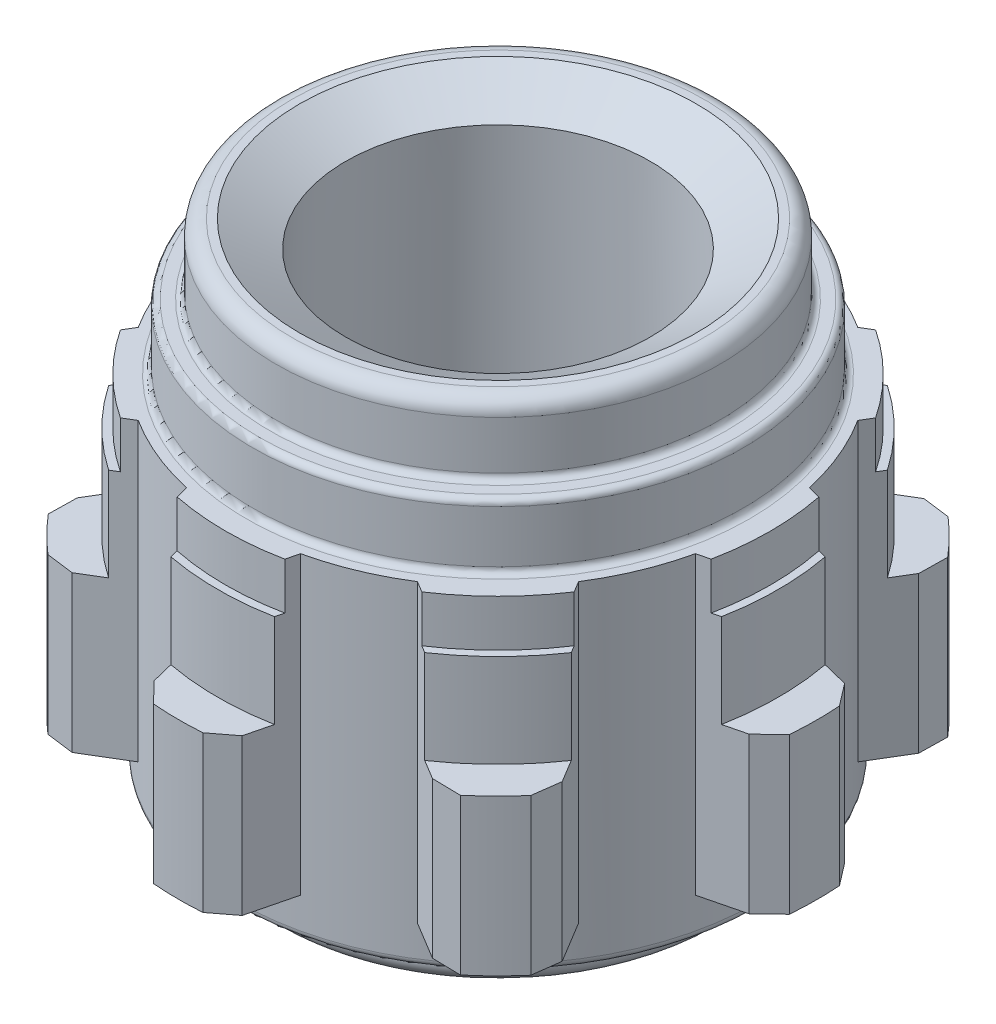
from build123d import *

# Parameters (mm, degrees)
CORTE_EXTRUS_O3_DEPTH = 93.584579839
CHANFRO1_SIZE         = 2.5
CHANFRO1_SIZE_2       = 1.443375673
CHANFRO1_SIZE_3       = 2.004509131
CHANFRO2_SIZE         = 6
CHANFRO2_SIZE2        = 3.422823391
CHANFRO3_SIZE         = 6
CHANFRO3_SIZE2        = 3.507995763
FILETE2_R             = 2
FILETE3_R             = 2
FILETE4_R             = 1
FILETE5_R             = 0.8
FILETE6_R             = 0.8


with BuildPart() as part:
    # Esboço1 → Revolução1 (revolve)
    with BuildSketch(Plane.XY):
        Polygon((40.409728023, 23.3), (49.409728023, 23.3), (49.409728023, 14.3), (52.409728023, 14.3), (52.409728023, 6), (55.909728023, 6), (55.909728023, 0), (56.909728023, 0), (56.909728023, -12), (61.909728023, -12), (61.909728023, -32), (54.409728023, -32), (54.409728023, -37), (49.409728023, -37), (49.409728023, -42), (41.799642187, -42), align=None)
    revolve(axis=Axis((20.909728023, -57.083369099, 0), (0, 1, 0)))

    # Esboço2 → Corte-extrusão3 (cut, through all)
    with BuildSketch(Plane.XZ.offset(32)):
        with BuildLine():
            ThreePointArc((-11.616680712, 24.960623686), (-16.96933281, 15.690020727), (-19.739742432, 5.349817913))
            Line((-19.739742432, 5.349817913), (-11.780061536, 7.323090779))
            ThreePointArc((-11.780061536, 7.323090779), (-10.040236316, 12.819894984), (-7.383650999, 17.936964724))
            Line((-7.383650999, 17.936964724), (-11.616680712, 24.960623686))
        make_face()
        with BuildLine():
            ThreePointArc((15.55991011, 40.649470455), (5.219707296, 37.879060833), (-4.050895663, 32.526408735))
            Line((-4.050895663, 32.526408735), (2.972763299, 28.293379022))
            ThreePointArc((2.972763299, 28.293379022), (8.089833039, 30.949964339), (13.586637245, 32.68978956))
            Line((13.586637245, 32.68978956), (15.55991011, 40.649470455))
        make_face()
        with BuildLine():
            ThreePointArc((45.870351709, 32.526408735), (36.59974875, 37.879060833), (26.259545937, 40.649470455))
            Line((26.259545937, 40.649470455), (28.232818802, 32.68978956))
            ThreePointArc((28.232818802, 32.68978956), (33.729623008, 30.949964339), (38.846692748, 28.293379022))
            Line((38.846692748, 28.293379022), (45.870351709, 32.526408735))
        make_face()
        with BuildLine():
            ThreePointArc((61.559198479, 5.349817913), (58.788788856, 15.690020727), (53.436136759, 24.960623686))
            Line((53.436136759, 24.960623686), (49.203107045, 17.936964724))
            ThreePointArc((49.203107045, 17.936964724), (51.859692363, 12.819894984), (53.599517583, 7.323090779))
            Line((53.599517583, 7.323090779), (61.559198479, 5.349817913))
        make_face()
        with BuildLine():
            Line((49.203107045, -17.936964724), (53.436136759, -24.960623686))
            ThreePointArc((53.436136759, -24.960623686), (58.788788856, -15.690020727), (61.559198479, -5.349817913))
            Line((61.559198479, -5.349817913), (53.599517583, -7.323090779))
            ThreePointArc((53.599517583, -7.323090779), (51.859692363, -12.819894984), (49.203107045, -17.936964724))
        make_face()
        with BuildLine():
            Line((28.232818802, -32.68978956), (26.259545937, -40.649470455))
            ThreePointArc((26.259545937, -40.649470455), (36.59974875, -37.879060833), (45.870351709, -32.526408735))
            Line((45.870351709, -32.526408735), (38.846692748, -28.293379022))
            ThreePointArc((38.846692748, -28.293379022), (33.729623008, -30.949964339), (28.232818802, -32.68978956))
        make_face()
        with BuildLine():
            Line((2.972763299, -28.293379022), (-4.050895663, -32.526408735))
            ThreePointArc((-4.050895663, -32.526408735), (5.219707296, -37.879060833), (15.55991011, -40.649470455))
            Line((15.55991011, -40.649470455), (13.586637245, -32.68978956))
            ThreePointArc((13.586637245, -32.68978956), (8.089833039, -30.949964339), (2.972763299, -28.293379022))
        make_face()
        with BuildLine():
            Line((-11.780061536, -7.323090779), (-19.739742432, -5.349817913))
            ThreePointArc((-19.739742432, -5.349817913), (-16.96933281, -15.690020727), (-11.616680712, -24.960623686))
            Line((-11.616680712, -24.960623686), (-7.383650999, -17.936964724))
            ThreePointArc((-7.383650999, -17.936964724), (-10.040236316, -12.819894984), (-11.780061536, -7.323090779))
        make_face()
    extrude(amount=-CORTE_EXTRUS_O3_DEPTH, mode=Mode.SUBTRACT)

    # Chanfro1
    # the kernel refuses this chamfer: 2.5, 2.004509131, 1.443375673 mm, written as the material it takes off along each edge
    with BuildSketch(Plane(origin=(20.909728023, -32, 0), x_dir=(0.284617484383171, 0, -0.9586411672692736), z_dir=(0.9586411672692736, 0, 0.284617484383171))) as chanfro1_piece_1:
        Polygon((41, CHANFRO1_SIZE), (41 - CHANFRO1_SIZE_2, 0), (41, 0), align=None)
    revolve(axis=Axis((20.909728023, -32, 0), (0, 1, 0)), revolution_arc=33.071970304, mode=Mode.SUBTRACT)
    with BuildSketch(Plane(origin=(26.259545937, -38.467714387, -40.649470455), x_dir=(0.24062455724554768, 0, 0.9706182681416955), z_dir=(0, 1, 0)), Plane(origin=(-4.050895663, -38.467714387, -32.526408735), x_dir=(0.8564780154949562, 0, 0.5161835031980602), z_dir=(0, 1, 0)), Plane(origin=(53.436136759, -38.467714387, -24.960623686), x_dir=(-0.5161835031980546, 0, 0.8564780154949595), z_dir=(0, 1, 0))) as chanfro1_piece_2:
        with BuildLine():
            Line((CHANFRO1_SIZE, 0), (-0.667872347, -1.828971953))
            ThreePointArc((-0.667872347, -1.828971953), (-0.357921183, -0.946519102), (0, 0))
            Line((0, 0), (CHANFRO1_SIZE, 0))
        make_face()
    extrude(amount=32.935428773, mode=Mode.SUBTRACT)
    with BuildSketch(Plane(origin=(20.909728023, -12, 0), x_dir=(0.2846174843831778, 0, -0.9586411672692715), z_dir=(0.9586411672692715, 0, 0.2846174843831778))) as chanfro1_piece_3:
        Polygon((41 - CHANFRO1_SIZE, 0), (41, -CHANFRO1_SIZE_2), (41, 0), align=None)
    revolve(axis=Axis((20.909728023, -12, 0), (0, 1, 0)), revolution_arc=33.071970304, mode=Mode.SUBTRACT)
    with BuildSketch(Plane(origin=(15.55991011, -38.167265311, -40.649470455), x_dir=(0.9948215341489756, 0, -0.10163717426945043), z_dir=(0, 1, 0)), Plane(origin=(53.436136759, -38.167265311, 24.960623686), x_dir=(-0.6315767177206731, 0, 0.7753133880136348), z_dir=(0, 1, 0)), Plane(origin=(26.259545937, -38.167265311, 40.649470455), x_dir=(-0.9948215341489772, 0, 0.10163717426943392), z_dir=(0, 1, 0)), Plane(origin=(-4.050895663, -38.167265311, 32.526408735), x_dir=(-0.7753133880136321, 0, -0.6315767177206766), z_dir=(0, 1, 0)), Plane(origin=(-19.739742432, -38.167265311, 5.349817913), x_dir=(-0.10163717426943429, 0, -0.9948215341489772), z_dir=(0, 1, 0)), Plane(origin=(-11.616680712, -38.167265311, -24.960623686), x_dir=(0.6315767177206676, 0, -0.7753133880136395), z_dir=(0, 1, 0)), Plane(origin=(61.559198479, -38.167265311, -5.349817913), x_dir=(0.10163717426943941, 0, 0.9948215341489767), z_dir=(0, 1, 0)), Plane(origin=(45.870351709, -38.167265311, -32.526408735), x_dir=(0.775313388013634, 0, 0.631576717720674), z_dir=(0, 1, 0))) as chanfro1_piece_4:
        with BuildLine():
            Line((2.381233502, 0), (-CHANFRO1_SIZE_3 * 0.338029389256, -CHANFRO1_SIZE_3 * 0.941135554513))
            Line((-CHANFRO1_SIZE_3 * 0.338029389256, -CHANFRO1_SIZE_3 * 0.941135554513), (0, 0))
            ThreePointArc((0, 0), (1.233164457, 0.017268987), (2.381233502, 0))
        make_face()
    extrude(amount=32.334530622, mode=Mode.SUBTRACT)
    with BuildSketch(Plane(origin=(45.870351709, -38.467714387, 32.526408735), x_dir=(0.7786474443812702, 0, -0.6274616779999529), z_dir=(0, 1, 0)), Plane(origin=(15.55991011, -38.467714387, 40.649470455), x_dir=(0.994269295524013, 0, 0.10690448062725404), z_dir=(0, 1, 0)), Plane(origin=(-11.616680712, -38.467714387, 24.960623686), x_dir=(0.6274616779999497, 0, 0.7786474443812729), z_dir=(0, 1, 0)), Plane(origin=(-19.739742432, -38.467714387, -5.349817913), x_dir=(-0.10690448062725709, 0, 0.9942692955240126), z_dir=(0, 1, 0)), Plane(origin=(61.559198479, -38.467714387, 5.349817913), x_dir=(0.10690448062725047, 0, -0.9942692955240133), z_dir=(0, 1, 0))) as chanfro1_piece_5:
        with BuildLine():
            Line((1.947098322, 0), (-CHANFRO1_SIZE * 0.343009050861, CHANFRO1_SIZE * 0.939332098369))
            Line((-CHANFRO1_SIZE * 0.343009050861, CHANFRO1_SIZE * 0.939332098369), (0, 0))
            ThreePointArc((0, 0), (1.01186598, -0.011542237), (1.947098322, 0))
        make_face()
    extrude(amount=32.935428773, mode=Mode.SUBTRACT)

    # Chanfro2
    chanfro2_edges = [part.edges().sort_by_distance(p)[0] for p in [
        (1.409728023, 23.3, 0),
    ]]
    chanfro2_side = [part.faces().sort_by_distance(p)[0] for p in [
        (0.603626293, 23.3, 0),
    ]]
    chamfer(chanfro2_edges, length=CHANFRO2_SIZE, length2=CHANFRO2_SIZE2, reference=chanfro2_side[0])

    # Chanfro3
    chanfro3_edges = [part.edges().sort_by_distance(p)[0] for p in [
        (0.01981386, -42, 0),
    ]]
    chanfro3_side = [part.faces().sort_by_distance(p)[0] for p in [
        (-6.784170246, -42, 0),
    ]]
    chamfer(chanfro3_edges, length=CHANFRO3_SIZE, length2=CHANFRO3_SIZE2, reference=chanfro3_side[0])

    # Filete2
    filete2_edges = [part.edges().sort_by_distance(p)[0] for p in [
        (-7.590271977, 23.3, 0),
    ]]
    fillet(filete2_edges, radius=FILETE2_R)

    # Filete3
    # the kernel refuses this fillet: 2 mm, written as the material it takes off along each edge
    with BuildSketch(Plane(origin=(20.909728023, -42, 0), x_dir=(1, 0, 0), z_dir=(0, 0, 1))) as filete3_piece_1:
        with BuildLine():
            CenterArc((26.5, 1.961623548), FILETE3_R, 281.242216427, 78.757783573)
            Line((28.5, 1.961623548), (28.54, 1.961623548))
            Line((28.54, 1.961623548), (28.54, 0))
            Line((28.54, 0), (28.5, -0.04))
            ThreePointArc((28.5, -0.04), (27.694957082, -0.04), (26.897712446, -0.039232471))
            Line((26.897712446, -0.039232471), (26.889914163, 0))
        make_face()
    revolve(axis=Axis((20.909728023, -42, 0), (0, 1, 0)), mode=Mode.SUBTRACT)

    # Filete4
    filete4_edges = [part.edges().sort_by_distance(p)[0] for p in [
        (-12.590271977, -37, 0),
    ]]
    fillet(filete4_edges, radius=FILETE4_R)

    # Filete5
    filete5_edges = [part.edges().sort_by_distance(p)[0] for p in [
        (-7.590271977, -37, 0),
    ]]
    fillet(filete5_edges, radius=FILETE5_R)

    # Filete6
    filete6_edges = [part.edges().sort_by_distance(p)[0] for p in [
        (-10.590271977, 6, 0),
        (-10.590271977, 14.3, 0),
        (-7.590271977, 14.3, 0),
    ]]
    fillet(filete6_edges, radius=FILETE6_R)


solid = part.part
